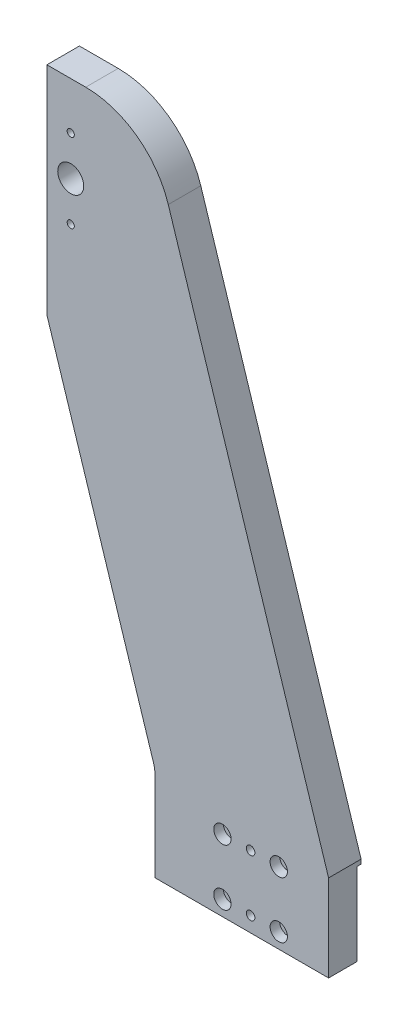
from build123d import *

# Parameters (mm, degrees)
SALIENTE_EXTRUIR1_DEPTH                              = 15
CROQUIS2_R                                           = 6
CORTAR_EXTRUIR1_DEPTH                                = 311.845620847
PERFORADOR_PARA_ROSCAR_PARA_MACHO_DE_ROS_D           = 3.3
PERFORADOR_PARA_ROSCAR_PARA_MACHO_DE_ROS_DEPTH       = 7
PERFORADOR_PARA_ROSCAR_PARA_MACHO_DE_ROS_TIP         = 0.991420021
CROQUIS9_W                                           = 80
CROQUIS9_H                                           = 38
CORTAR_EXTRUIR2_DEPTH                                = 2
PERFORADOR_PARA_ROSCAR_PARA_MACHO_DE_2_D             = 3.3
PERFORADOR_PARA_ROSCAR_PARA_MACHO_DE_2_DEPTH         = 15
PERFORADOR_PARA_ROSCAR_PARA_MACHO_DE_2_TIP           = 0.991420021
TALADROS_DE_ESPIGA_DE_4_0MM1_D                       = 4
TALADROS_DE_ESPIGA_DE_4_0MM1_DEPTH                   = 17
TALADROS_DE_ESPIGA_DE_4_0MM1_TIP                     = 1.201721238
TALADROS_DE_ESPIGA_DE_4_0MM3_D                       = 4
REFRENTADO_PARA_TORNILLO_CON_CABEZA_HUEC_D           = 4.5
REFRENTADO_PARA_TORNILLO_CON_CABEZA_HUEC_CBORE_D     = 8
REFRENTADO_PARA_TORNILLO_CON_CABEZA_HUEC_CBORE_DEPTH = 4.4


with BuildPart() as part:
    # Croquis1 → Saliente-Extruir1 (new body)
    with BuildSketch(Plane.XY):
        with BuildLine():
            Line((80, 0), (80, 40))
            Line((80, 40), (6.016406662, 272.145884266))
            ThreePointArc((6.016406662, 272.145884266), (-8.492384821, 292.294236101), (-32.094976092, 300))
            Line((-32.094976092, 300), (-50, 300))
            Line((-50, 300), (-50, 200))
            Line((-50, 200), (-0.944308623, 46.072942133))
            ThreePointArc((-0.944308623, 46.072942133), (-0.23748716, 43.0729605), (0, 40))
            Line((0, 40), (0, 0))
            Line((0, 0), (80, 0))
        make_face()
    extrude(amount=SALIENTE_EXTRUIR1_DEPTH)

    # Croquis2 → Cortar-Extruir1 (cut, through all)
    with BuildSketch(Plane(origin=(0, 0, 0), x_dir=(-1, 0, 0), z_dir=(0, 0, -1))):
        with Locations((39, 260)):
            Circle(CROQUIS2_R)
    extrude(amount=-CORTAR_EXTRUIR1_DEPTH, mode=Mode.SUBTRACT)

    # Perforador para roscar para macho de ros
    with Locations(Plane.XY.offset(15)):
        with Locations((-39, 278.25), (-39, 241.75)):
            Hole(PERFORADOR_PARA_ROSCAR_PARA_MACHO_DE_ROS_D / 2, depth=PERFORADOR_PARA_ROSCAR_PARA_MACHO_DE_ROS_DEPTH)
            with Locations((0, 0, -(PERFORADOR_PARA_ROSCAR_PARA_MACHO_DE_ROS_DEPTH + PERFORADOR_PARA_ROSCAR_PARA_MACHO_DE_ROS_TIP / 2))):  # 118° drill point
                Cone(0, PERFORADOR_PARA_ROSCAR_PARA_MACHO_DE_ROS_D / 2, PERFORADOR_PARA_ROSCAR_PARA_MACHO_DE_ROS_TIP, mode=Mode.SUBTRACT)

    # Croquis9 → Cortar-Extruir2 (cut)
    with BuildSketch(Plane(origin=(0, 0, 0), x_dir=(-1, 0, 0), z_dir=(0, 0, -1))):
        with Locations((-40, 19)):
            Rectangle(CROQUIS9_W, CROQUIS9_H)
    extrude(amount=-CORTAR_EXTRUIR2_DEPTH, mode=Mode.SUBTRACT)

    # Perforador para roscar para macho de 2
    with Locations(Plane.ZY.offset(50)):
        with Locations((9, 285), (9, 235)):
            Hole(PERFORADOR_PARA_ROSCAR_PARA_MACHO_DE_2_D / 2, depth=PERFORADOR_PARA_ROSCAR_PARA_MACHO_DE_2_DEPTH)
            with Locations((0, 0, -(PERFORADOR_PARA_ROSCAR_PARA_MACHO_DE_2_DEPTH + PERFORADOR_PARA_ROSCAR_PARA_MACHO_DE_2_TIP / 2))):  # 118° drill point
                Cone(0, PERFORADOR_PARA_ROSCAR_PARA_MACHO_DE_2_D / 2, PERFORADOR_PARA_ROSCAR_PARA_MACHO_DE_2_TIP, mode=Mode.SUBTRACT)

    # Taladros de espiga de Ø4.0mm1
    with Locations(Plane.ZY.offset(50)):
        with Locations((9, 274), (9, 246)):
            Hole(TALADROS_DE_ESPIGA_DE_4_0MM1_D / 2, depth=TALADROS_DE_ESPIGA_DE_4_0MM1_DEPTH)
            with Locations((0, 0, -(TALADROS_DE_ESPIGA_DE_4_0MM1_DEPTH + TALADROS_DE_ESPIGA_DE_4_0MM1_TIP / 2))):  # 118° drill point
                Cone(0, TALADROS_DE_ESPIGA_DE_4_0MM1_D / 2, TALADROS_DE_ESPIGA_DE_4_0MM1_TIP, mode=Mode.SUBTRACT)

    # Taladros de espiga de Ø4.0mm3 (through all)
    with Locations(Plane.XY.offset(15)):
        with Locations((44, 33), (44, 7)):
            Hole(TALADROS_DE_ESPIGA_DE_4_0MM3_D / 2)

    # Refrentado para tornillo con cabeza hueca de M41 (through all)
    with Locations(Plane.XY.offset(15)):
        with Locations((57, 33), (31, 7), (31, 33), (57, 7)):
            CounterBoreHole(REFRENTADO_PARA_TORNILLO_CON_CABEZA_HUEC_D / 2, REFRENTADO_PARA_TORNILLO_CON_CABEZA_HUEC_CBORE_D / 2, REFRENTADO_PARA_TORNILLO_CON_CABEZA_HUEC_CBORE_DEPTH)


solid = part.part
